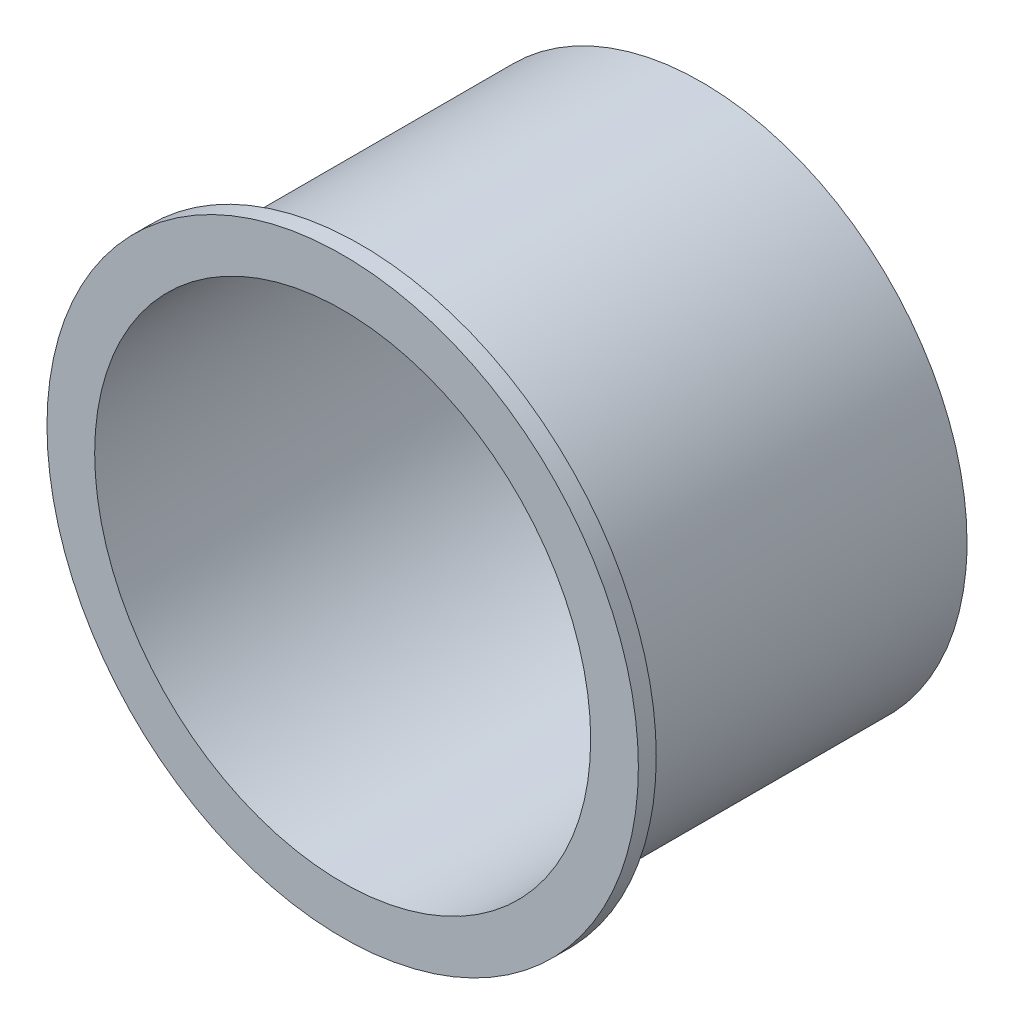
from build123d import *

# Parameters (mm, degrees)
EXTRUDE1_START       = -45.41253676
EXTRUDE1_OUTLINE_R   = 35.40125
EXTRUDE1_OUTLINE_R_2 = 33.02
EXTRUDE1_DEPTH       = 45.41253676
EXTRUDE1_START_2     = -46
EXTRUDE1_2_OUTLINE_W = 74
EXTRUDE1_2_OUTLINE_H = 74
EXTRUDE1_2_DEPTH     = 0.655049908
SKETCH2_R            = 39.37
SKETCH2_R_2          = 33.02
EXTRUDE2_DEPTH       = 2.38125


with BuildPart() as part:
    # Extrude1: read off the stored shape, not the designer's step
    # Extrude1 outline → Extrude1 (new body)
    with BuildSketch(Plane.XY.offset(EXTRUDE1_START)):
        Circle(EXTRUDE1_OUTLINE_R)
        Circle(EXTRUDE1_OUTLINE_R_2, mode=Mode.SUBTRACT)
    extrude(amount=EXTRUDE1_DEPTH)

    # Extrude1 2 outline → Extrude1 2 (cut)
    with BuildSketch(Plane(origin=(0, 0, 0), x_dir=(1, 0, 0), z_dir=(0, 0.0019068255537502605, 0.9999981820065013)).offset(EXTRUDE1_START_2)):
        Rectangle(EXTRUDE1_2_OUTLINE_W, EXTRUDE1_2_OUTLINE_H)
    extrude(amount=EXTRUDE1_2_DEPTH, mode=Mode.SUBTRACT)

    # Sketch2 → Extrude2 (add)
    with BuildSketch(Plane.XY):
        with Locations(Location((0, 0, 0), (0, 0, 180))):
            Circle(SKETCH2_R)
        Circle(SKETCH2_R_2, mode=Mode.SUBTRACT)
    extrude(amount=EXTRUDE2_DEPTH)


solid = part.part
